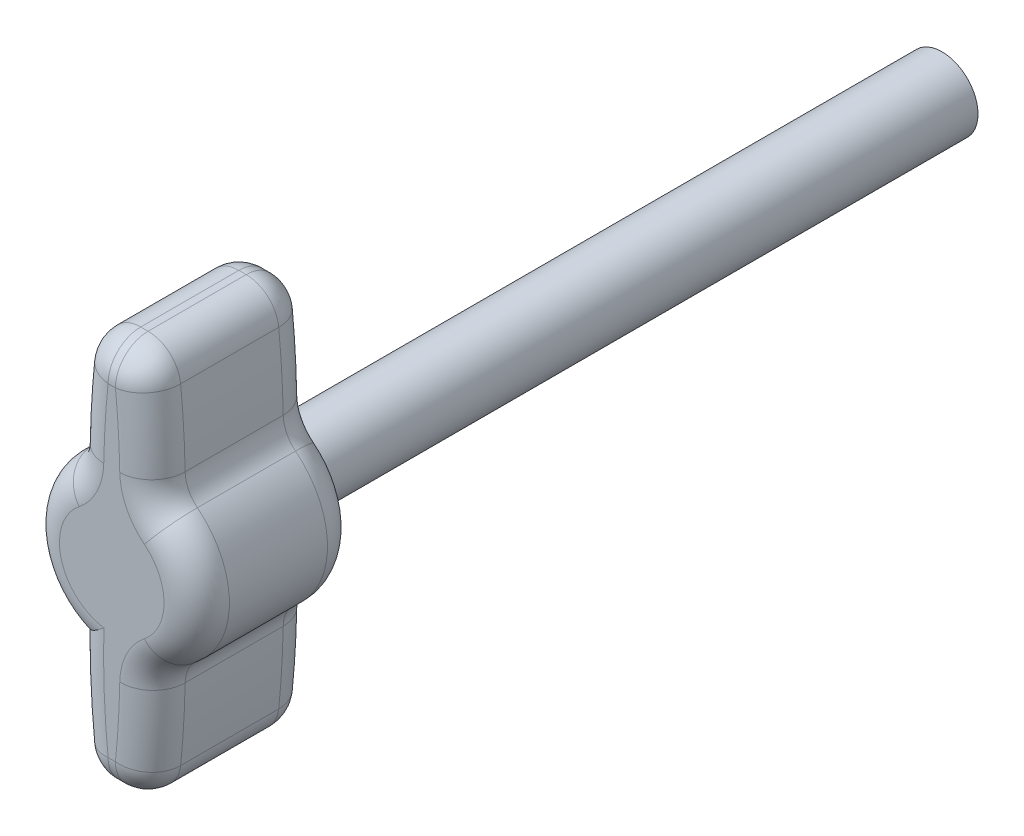
from build123d import *

# Parameters (mm, degrees)
SKETCH1_R      = 2.794
EXTRUDE1_DEPTH = 51.816
SKETCH2_R      = 6.604
EXTRUDE2_DEPTH = 12.7
EXTRUDE3_START = -12.7
EXTRUDE3_DEPTH = 12.7
FILLET1_R      = 2.54
FILLET2_R      = 2.54


with BuildPart() as part:
    # Sketch1 → Extrude1 (new body)
    with BuildSketch(Plane.XY):
        Circle(SKETCH1_R)
    extrude(amount=EXTRUDE1_DEPTH)

    # Sketch2 → Extrude2 (add)
    with BuildSketch(Plane.XY.offset(51.816)):
        Circle(SKETCH2_R)
    extrude(amount=EXTRUDE2_DEPTH)

    # Sketch3 → Extrude3 (add)
    with BuildSketch(Plane.XY.offset(64.516).offset(EXTRUDE3_START)):
        with BuildLine():
            Line((-2.54, 15.122583735), (2.54, 15.122583735))
            ThreePointArc((2.54, 15.122583735), (3.016066659, 10.467431069), (3.175, 5.790698663))
            ThreePointArc((3.175, 5.790698663), (0, 6.604), (-3.175, 5.790698663))
            ThreePointArc((-3.175, 5.790698663), (-3.016066659, 10.467431069), (-2.54, 15.122583735))
        make_face()
        with BuildLine():
            Line((2.54, -15.122583735), (-2.54, -15.122583735))
            ThreePointArc((-2.54, -15.122583735), (-3.016066659, -10.467431069), (-3.175, -5.790698663))
            ThreePointArc((-3.175, -5.790698663), (0, -6.604), (3.175, -5.790698663))
            ThreePointArc((3.175, -5.790698663), (3.016066659, -10.467431069), (2.54, -15.122583735))
        make_face()
    extrude(amount=EXTRUDE3_DEPTH)

    # Fillet1
    fillet1_edges = [part.edges().sort_by_distance(p)[0] for p in [
        (-2.54, 15.122583735, 58.166),
        (2.54, 15.122583735, 58.166),
        (2.54, -15.122583735, 58.166),
        (-2.54, -15.122583735, 58.166),
    ]]
    fillet(fillet1_edges, radius=FILLET1_R)

    # Fillet2
    fillet2_edges = [part.edges().sort_by_distance(p)[0] for p in [
        (-3.175, 5.790698663, 58.166),
        (3.175, 5.790698663, 58.166),
        (3.175, -5.790698663, 58.166),
    ]]
    fillet(fillet2_edges, radius=FILLET2_R)
    fillet2_2_edges = [part.edges().sort_by_distance(p)[0] for p in [
        (-6.57965204, -0.566564238, 51.816),
        (3.047804414, 9.974982228, 64.516),
        (-3.047804414, 9.974982228, 51.816),
        (6.604, 0, 64.516),
        (6.604, 0, 51.816),
        (-3.084466617, -9.321288711, 64.516),
        (3.047804414, -9.974982228, 51.816),
        (-3.084466617, -9.321288711, 51.816),
        (0, -15.122583735, 64.516),
        (3.047804414, -9.974982228, 64.516),
        (0, 15.122583735, 64.516),
        (-3.047804414, 9.974982228, 64.516),
        (1.98808874, 14.468324748, 64.516),
        (-1.98808874, 14.468324748, 64.516),
        (1.98808874, -14.468324748, 64.516),
        (-1.98808874, -14.468324748, 64.516),
        (0, -15.122583735, 51.816),
        (0, 15.122583735, 51.816),
        (3.047804414, 9.974982228, 51.816),
        (1.98808874, 14.468324748, 51.816),
        (-1.98808874, 14.468324748, 51.816),
        (1.98808874, -14.468324748, 51.816),
        (-1.98808874, -14.468324748, 51.816),
        (-6.57965204, -0.566564238, 64.516),
        (-3.424141618, 6.02472451, 64.516),
        (3.424141618, 6.02472451, 51.816),
        (3.424141618, -6.02472451, 64.516),
        (3.424141618, -6.02472451, 51.816),
        (3.424141618, 6.02472451, 64.516),
        (-3.424141618, 6.02472451, 51.816),
    ]]
    fillet(fillet2_2_edges, radius=FILLET2_R)


solid = part.part
